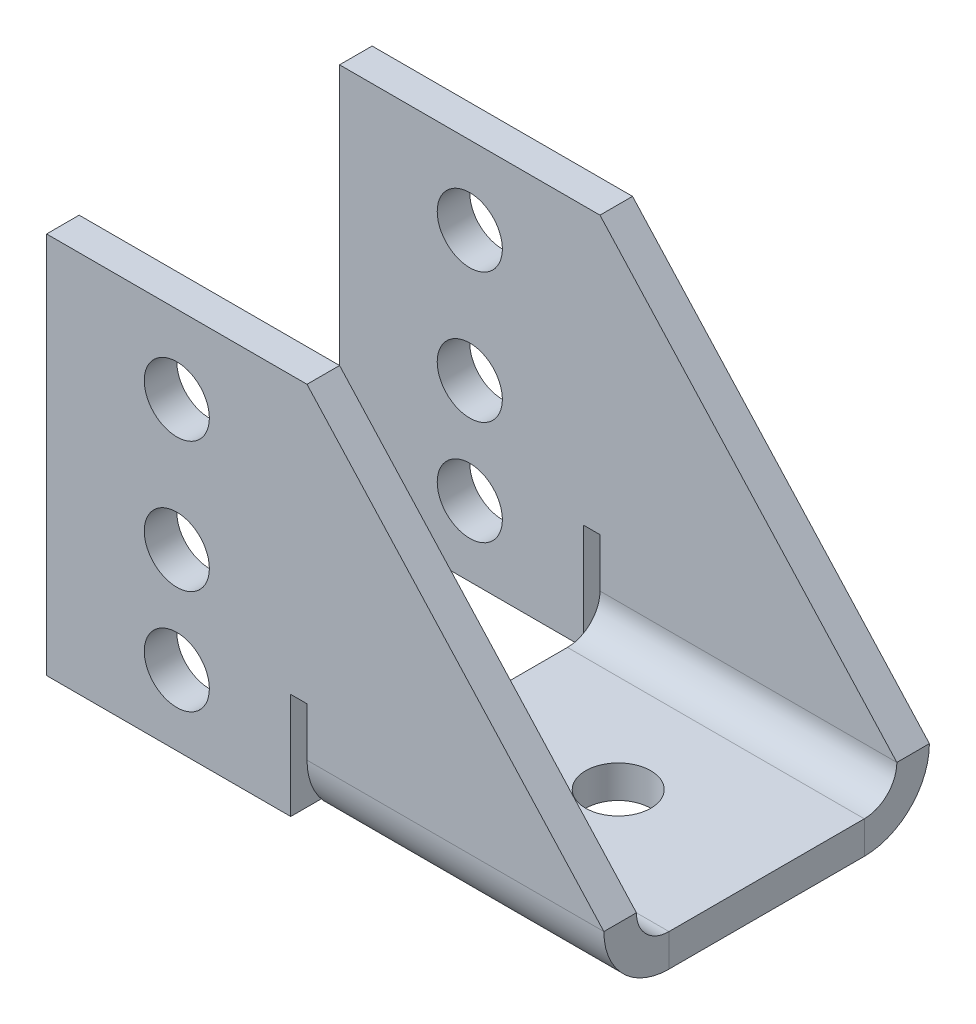
from build123d import *

# Parameters (mm, degrees)
BOSS_EXTRUDE1_DEPTH     = 3.175
SKETCH2_W               = 28.956
SKETCH2_H               = 3.175
BOSS_EXTRUDE2_DEPTH     = 25.4
CUT_EXTRUDE1_DEPTH      = 74.581568589
CUT_EXTRUDE1_DEPTH_BACK = 74.581568589
SKETCH3_R               = 3.175
CUT_EXTRUDE2_DEPTH      = 71.646025975
CUT_EXTRUDE2_DEPTH_BACK = 71.646025975
SKETCH6_R               = 3.175
CUT_EXTRUDE3_DEPTH      = 74.581568589
CUT_EXTRUDE3_DEPTH_BACK = 74.581568589
SKETCH7_W               = 25.4
SKETCH7_H               = 0.79375
CONVERT_SOLID1_START    = 23.8125
CONVERT_SOLID1_DEPTH    = 30.5435
CONVERT_SOLID1_2_DEPTH  = 1.5875
CONVERT_SOLID1_START_2  = 25.4
CONVERT_SOLID1_3_DEPTH  = 28.956


# Read off the part's stored shape, not the designer's step: Convert-Solid1
with BuildPart() as part:
    # Sketch1 → Boss-Extrude1 (new body)
    with BuildSketch(Plane.XY):
        Polygon((54.356, 6.35), (25.4, 38.1), (0, 38.1), (0, 0), (54.356, 0), align=None)
    boss_extrude1 = extrude(amount=BOSS_EXTRUDE1_DEPTH)

    # Sketch2 → Boss-Extrude2 (add)
    with BuildSketch(Plane(origin=(0, 0, 0), x_dir=(-1, 0, 0), z_dir=(0, 0, -1))):
        with Locations((-39.878, 1.5875)):
            Rectangle(SKETCH2_W, SKETCH2_H)
    extrude(amount=BOSS_EXTRUDE2_DEPTH)

    # Mirror1: Boss-Extrude1 across plane
    add(boss_extrude1.mirror(Plane.XY.offset(-12.7)))

    # Sketch3 → Cut-Extrude1 (cut, two sides: drawn at the far end of the back side and taken through both)
    with BuildSketch(Plane.XY.offset(3.175).offset(-CUT_EXTRUDE1_DEPTH_BACK)):
        with Locations((12.7, 7.62)):
            Circle(SKETCH3_R)
        with Locations((12.7, 17.78)):
            Circle(SKETCH3_R)
        with Locations((12.7, 30.48)):
            Circle(SKETCH3_R)
    extrude(amount=CUT_EXTRUDE1_DEPTH + CUT_EXTRUDE1_DEPTH_BACK, mode=Mode.SUBTRACT)

    # Sketch6 → Cut-Extrude2 (cut, two sides: drawn at the far end of the back side and taken through both)
    with BuildSketch(Plane(origin=(0, 3.175, 0), x_dir=(1, 0, 0), z_dir=(0, 1, 0)).offset(-CUT_EXTRUDE2_DEPTH_BACK)):
        with Locations(Location((39.878, 12.7, 0), (0, 0, 270))):
            Circle(SKETCH6_R)
    extrude(amount=CUT_EXTRUDE2_DEPTH + CUT_EXTRUDE2_DEPTH_BACK, mode=Mode.SUBTRACT)

    # Sketch7 → Cut-Extrude3 (cut, two sides: drawn at the far end of the back side and taken through both)
    with BuildSketch(Plane(origin=(0, 0, -28.575), x_dir=(-1, 0, 0), z_dir=(0, 0, -1)).offset(-CUT_EXTRUDE3_DEPTH_BACK)):
        with Locations((-12.7, 0.396875)):
            Rectangle(SKETCH7_W, SKETCH7_H)
    extrude(amount=CUT_EXTRUDE3_DEPTH + CUT_EXTRUDE3_DEPTH_BACK, mode=Mode.SUBTRACT)

    # Convert-Solid1 outline → Convert-Solid1 (cut)
    with BuildSketch(Plane.YZ.offset(CONVERT_SOLID1_START)):
        with BuildLine():
            Line((0, -28.575), (6.35, -28.575))
            ThreePointArc((6.35, -28.575), (3.174999999, -27.724261314), (0.850738685, -25.4))
            ThreePointArc((0.850738685, -25.4), (0.216371003, -23.868500936), (0, -22.225))
            Line((0, -22.225), (0, -28.575))
        make_face()
        with BuildLine():
            Line((0, 3.175), (0, -3.175))
            ThreePointArc((0, -3.175), (0.216371003, -1.531499064), (0.850738685, 0))
            ThreePointArc((0.850738685, 0), (3.174999999, 2.324261314), (6.35, 3.175))
            Line((6.35, 3.175), (0, 3.175))
        make_face()
    extrude(amount=CONVERT_SOLID1_DEPTH, mode=Mode.SUBTRACT)

    # Convert-Solid1 2 outline → Convert-Solid1 2 (cut)
    with BuildSketch(Plane.YZ.offset(CONVERT_SOLID1_START)):
        with BuildLine():
            Line((6.35, -28.575), (11.1125, -28.575))
            Line((11.1125, -28.575), (11.1125, -25.4))
            Line((11.1125, -25.4), (0.850738685, -25.4))
            ThreePointArc((0.850738685, -25.4), (3.174999999, -27.724261314), (6.35, -28.575))
        make_face()
        with BuildLine():
            Line((0.850738685, 0), (11.1125, 0))
            Line((11.1125, 0), (11.1125, 3.175))
            Line((11.1125, 3.175), (6.35, 3.175))
            ThreePointArc((6.35, 3.175), (3.174999999, 2.324261314), (0.850738685, 0))
        make_face()
    extrude(amount=CONVERT_SOLID1_2_DEPTH, mode=Mode.SUBTRACT)

    # Convert-Solid1 3 outline → Convert-Solid1 3 (add)
    with BuildSketch(Plane.YZ.offset(CONVERT_SOLID1_START_2)):
        with BuildLine():
            Line((3.175, -25.4), (6.35, -25.4))
            ThreePointArc((6.35, -25.4), (4.10493597, -24.47006403), (3.175, -22.225))
            Line((3.175, -22.225), (3.175, -25.4))
        make_face()
        with BuildLine():
            Line((3.175, 0), (3.175, -3.175))
            ThreePointArc((3.175, -3.175), (4.10493597, -0.92993597), (6.35, 0))
            Line((6.35, 0), (3.175, 0))
        make_face()
    extrude(amount=CONVERT_SOLID1_3_DEPTH)


solid = part.part
